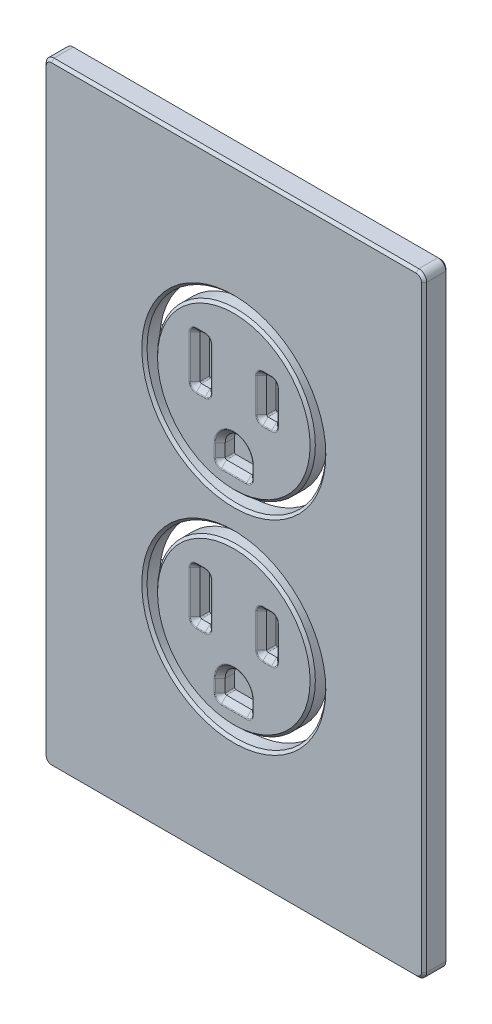
from build123d import *

# Parameters (mm, degrees)
SKETCH1_W                                    = 69.596
SKETCH1_H                                    = 114.046
FLANGE_EXTRUSION_DEPTH                       = 6.35
SKETCH2_W                                    = 63.6
SKETCH2_H                                    = 108
MOUNTING_BASE_CLEARANCE_CUT_DEPTH            = 3.25
MOUNTING_BASE_CLEARANCE_CUT_FILLETS_R        = 9.5
LIGHT_PIPE_CLEARANCE_OUTLINE_W               = 69.596
LIGHT_PIPE_CLEARANCE_OUTLINE_H               = 114.046
LIGHT_PIPE_CLEARANCE_DEPTH                   = 1.7
PERIMETER_OVERHANG_EXTENSION_BY              = 1.5
PERIMETER_OVERHANG_EXTENSION_2_BY            = 1.5
PERIMETER_OVERHANG_EXTENSION_3_BY            = 1.5
PERIMETER_OVERHANG_EXTENSION_4_BY            = 1.5
CORNER_ROUNDS_R                              = 1.5
PERIMETER_CHAMFERS_SIZE                      = 0.5
LIGHTPIPE_CHANNEL_DEPTH                      = 69.935450481
LIGHTPIPE_CHANNEL_DEPTH_BACK                 = 2.1
LIGHTPIPE_CHANNEL_DRAFT_ANGLE                = 15
LIGHTPIPE_CHANNEL_INSIDE_FILLETS_R           = 2.25
LIGHTPIPE_CHANNEL_OUTSIDE_ROUNDS_R           = 1
SKETCH14_R                                   = 1.25
LIGHTPIPE_MOUNTING_HOLE_DEPTH                = 3.25
LIGHTPIPE_MOUNTING_HOLE_MIRROR_2_COPY_1_R    = 1.25
LIGHTPIPE_MOUNTING_HOLE_MIRROR_2_COP_2_DEPTH = 3.25
LIGHTPIPE_START                              = 3.25
LIGHTPIPE_PCB_CLEARANCE_DEPTH                = 0.2
SKETCH18_R                                   = 17.0561
SKETCH18_R_2                                 = 15.0561
RECEPTACLE_INSERT_HOLES_DEPTH                = 70.022524099
SKETCH20_W                                   = 2
SKETCH20_H                                   = 15
SKETCH20_W_2                                 = 8
SKETCH20_H_2                                 = 2
BOSS_EXTRUDE1_DEPTH                          = 2
RECEPTACLE_INSERT_HOLES_CHAMFERS_SIZE        = 0.5
SKETCH19_W                                   = 2.159
SKETCH19_H                                   = 8.636
SKETCH19_H_2                                 = 6.985
CUT_EXTRUDE1_DEPTH                           = 2.8
FILLET1_R                                    = 0.25
CHAMFER1_SIZE                                = 1
FILLET2_R                                    = 0.25
CHAMFER2_SIZE                                = 0.5


with BuildPart() as part:
    # Sketch1 → Flange Extrusion (new body)
    with BuildSketch(Plane.XY):
        Rectangle(SKETCH1_W, SKETCH1_H)
    extrude(amount=FLANGE_EXTRUSION_DEPTH)

    # Sketch2 → Mounting Base Clearance Cut (cut)
    with BuildSketch(Plane(origin=(0, 0, 0), x_dir=(-1, 0, 0), z_dir=(0, 0, -1))):
        Rectangle(SKETCH2_W, SKETCH2_H)
    extrude(amount=-MOUNTING_BASE_CLEARANCE_CUT_DEPTH, mode=Mode.SUBTRACT)

    # Mounting Base Clearance Cut Fillets
    mounting_base_clearance_cut_fillets_edges = [part.edges().sort_by_distance(p)[0] for p in [
        (-31.8, -54, 1.625),
        (-31.8, 54, 1.625),
        (31.8, 54, 1.625),
        (31.8, -54, 1.625),
    ]]
    fillet(mounting_base_clearance_cut_fillets_edges, radius=MOUNTING_BASE_CLEARANCE_CUT_FILLETS_R)

    # Light Pipe Clearance: read off the stored shape, not the designer's step
    # Light Pipe Clearance outline → Light Pipe Clearance (cut)
    with BuildSketch(Plane.XY):
        Rectangle(LIGHT_PIPE_CLEARANCE_OUTLINE_W, LIGHT_PIPE_CLEARANCE_OUTLINE_H)
        with BuildLine():
            Line((22.3, -54), (-22.3, -54))
            ThreePointArc((-22.3, -54), (-29.017514421, -51.217514421), (-31.8, -44.5))
            Line((-31.8, -44.5), (-31.8, 44.5))
            ThreePointArc((-31.8, 44.5), (-29.017514421, 51.217514421), (-22.3, 54))
            Line((-22.3, 54), (22.3, 54))
            ThreePointArc((22.3, 54), (29.017514421, 51.217514421), (31.8, 44.5))
            Line((31.8, 44.5), (31.8, -44.5))
            ThreePointArc((31.8, -44.5), (29.017514421, -51.217514421), (22.3, -54))
        make_face(mode=Mode.SUBTRACT)
    extrude(amount=LIGHT_PIPE_CLEARANCE_DEPTH, mode=Mode.SUBTRACT)

    # Perimeter Overhang Extension: a face moved outward by 1.5
    extrude(part.faces().sort_by_distance((0, 57.023, 4.025))[0], amount=PERIMETER_OVERHANG_EXTENSION_BY, dir=(0, 1, 0))

    # Perimeter Overhang Extension 2: a face moved outward by 1.5
    extrude(part.faces().sort_by_distance((-34.798, 0, 4.025))[0], amount=PERIMETER_OVERHANG_EXTENSION_2_BY, dir=(-1, 0, 0))

    # Perimeter Overhang Extension 3: a face moved outward by 1.5
    extrude(part.faces().sort_by_distance((34.798, 0, 4.025))[0], amount=PERIMETER_OVERHANG_EXTENSION_3_BY, dir=(1, 0, 0))

    # Perimeter Overhang Extension 4: a face moved outward by 1.5
    extrude(part.faces().sort_by_distance((0, -57.023, 4.025))[0], amount=PERIMETER_OVERHANG_EXTENSION_4_BY, dir=(0, -1, 0))

    # Corner Rounds
    corner_rounds_edges = [part.edges().sort_by_distance(p)[0] for p in [
        (-36.298, 58.523, 4.025),
        (36.298, 58.523, 4.025),
        (36.298, -58.523, 4.025),
        (-36.298, -58.523, 4.025),
    ]]
    fillet(corner_rounds_edges, radius=CORNER_ROUNDS_R)

    # Perimeter Chamfers
    perimeter_chamfers_edges = [part.edges().sort_by_distance(p)[0] for p in [
        (-36.298, 0, 1.7),
        (-36.298, 0, 6.35),
        (0, 58.523, 1.7),
        (36.298, 0, 1.7),
        (0, -58.523, 1.7),
        (-35.858660172, -58.083660172, 1.7),
        (35.858660172, -58.083660172, 1.7),
        (35.858660172, 58.083660172, 1.7),
        (-35.858660172, 58.083660172, 1.7),
        (0, 58.523, 6.35),
        (0, -58.523, 6.35),
        (36.298, 0, 6.35),
        (-35.858660172, -58.083660172, 6.35),
        (35.858660172, -58.083660172, 6.35),
        (35.858660172, 58.083660172, 6.35),
        (-35.858660172, 58.083660172, 6.35),
    ]]
    chamfer(perimeter_chamfers_edges, length=PERIMETER_CHAMFERS_SIZE)

    # Sketch13 → Lightpipe Channel (cut, two sides: drawn at the far end of the back side and taken through both)
    with BuildSketch(Plane(origin=(0, 0, 3.25), x_dir=(-1, 0, 0), z_dir=(0, 0, -1)).offset(-LIGHTPIPE_CHANNEL_DEPTH_BACK)):
        with BuildLine():
            Line((22.3, 54.65), (-22.3, 54.65))
            ThreePointArc((-22.3, 54.65), (-29.477133829, 51.677133829), (-32.45, 44.5))
            Line((-32.45, 44.5), (-32.45, -44.5))
            ThreePointArc((-32.45, -44.5), (-29.477133829, -51.677133829), (-22.3, -54.65))
            Line((-22.3, -54.65), (22.3, -54.65))
            ThreePointArc((22.3, -54.65), (29.477133829, -51.677133829), (32.45, -44.5))
            Line((32.45, -44.5), (32.45, 44.5))
            ThreePointArc((32.45, 44.5), (29.477133829, 51.677133829), (22.3, 54.65))
        make_face()
        with BuildLine():
            Line((22.3, 51), (-22.3, 51))
            ThreePointArc((-22.3, 51), (-26.896194078, 49.096194078), (-28.8, 44.5))
            Line((-28.8, 44.5), (-28.8, -44.5))
            ThreePointArc((-28.8, -44.5), (-26.896194078, -49.096194078), (-22.3, -51))
            Line((-22.3, -51), (22.3, -51))
            ThreePointArc((22.3, -51), (26.896194078, -49.096194078), (28.8, -44.5))
            Line((28.8, -44.5), (28.8, 44.5))
            ThreePointArc((28.8, 44.5), (26.896194078, 49.096194078), (22.3, 51))
        make_face(mode=Mode.SUBTRACT)
    extrude(amount=LIGHTPIPE_CHANNEL_DEPTH + LIGHTPIPE_CHANNEL_DEPTH_BACK, mode=Mode.SUBTRACT)

    # Lightpipe Channel Draft
    lightpipe_channel_draft_faces = [part.faces().sort_by_distance(p)[0] for p in [
        (0, 51, 4.3),
        (26.896194078, 49.096194078, 4.3),
        (28.8, 0, 4.3),
        (26.896194078, -49.096194078, 4.3),
        (0, -51, 4.3),
        (-26.896194078, -49.096194078, 4.3),
        (-28.8, 0, 4.3),
        (-26.896194078, 49.096194078, 4.3),
        (-32.45, 0, 3.525),
        (-29.477133829, 51.677133829, 3.525),
        (0, 54.65, 3.525),
        (29.477133829, 51.677133829, 3.525),
        (32.45, 0, 3.525),
        (29.477133829, -51.677133829, 3.525),
        (0, -54.65, 3.525),
        (-29.477133829, -51.677133829, 3.525),
    ]]
    draft(lightpipe_channel_draft_faces, Plane(origin=(0, 0, 5.35), x_dir=(-1, 0, 0), z_dir=(0, 0, -1)), LIGHTPIPE_CHANNEL_DRAFT_ANGLE)

    # Lightpipe Channel Inside Fillets
    lightpipe_channel_inside_fillets_edges = [part.edges().sort_by_distance(p)[0] for p in [
        (-29.477133829, 51.677133829, 5.35),
        (-32.45, 0, 5.35),
        (-29.477133829, -51.677133829, 5.35),
        (0, -54.65, 5.35),
        (29.477133829, -51.677133829, 5.35),
        (32.45, 1.69e-07, 5.35),
        (29.477131824, 51.677135834, 5.35),
        (-2.667e-06, 54.65, 5.35),
        (-28.8, -1.12e-07, 5.35),
        (-26.896194078, 49.096194078, 5.35),
        (0, 51, 5.35),
        (26.896194078, 49.096194078, 5.35),
        (28.8, 0, 5.35),
        (26.896193999, -49.096194157, 5.35),
        (-1.12e-07, -51, 5.35),
        (-26.896193999, -49.096194157, 5.35),
    ]]
    fillet(lightpipe_channel_inside_fillets_edges, radius=LIGHTPIPE_CHANNEL_INSIDE_FILLETS_R)

    # Lightpipe Channel Outside Rounds
    lightpipe_channel_outside_rounds_edges = [part.edges().sort_by_distance(p)[0] for p in [
        (-30.168694551, 52.368694551, 1.7),
        (0, 55.628014552, 1.7),
        (30.168694551, 52.368694551, 1.7),
        (33.428014552, 0, 1.7),
        (30.168694551, -52.368694551, 1.7),
        (0, -55.628014552, 1.7),
        (-30.168694551, -52.368694551, 1.7),
        (-33.428014552, 0, 1.7),
    ]]
    fillet(lightpipe_channel_outside_rounds_edges, radius=LIGHTPIPE_CHANNEL_OUTSIDE_ROUNDS_R)

    # Sketch14 → Lightpipe Mounting Hole (cut)
    with BuildSketch(Plane(origin=(0, 0, 1.7), x_dir=(-1, 0, 0), z_dir=(0, 0, -1))):
        with Locations((-32, 54.219403104)):
            Circle(SKETCH14_R)
    lightpipe_mounting_hole = extrude(amount=-LIGHTPIPE_MOUNTING_HOLE_DEPTH, mode=Mode.SUBTRACT)

    # Lightpipe Mounting Hole Mirror: Lightpipe Mounting Hole across plane
    add(lightpipe_mounting_hole.mirror(Plane(origin=(0, 0, 0), x_dir=(0, 0, 1), z_dir=(1, 0, 0))), mode=Mode.SUBTRACT)

    # Lightpipe Mounting Hole Mirror 2: Lightpipe Mounting Hole across plane
    add(lightpipe_mounting_hole.mirror(Plane.ZX), mode=Mode.SUBTRACT)

    # Lightpipe Mounting Hole Mirror 2 copy 1 → Lightpipe Mounting Hole Mirror 2 cop 2 (cut)
    with BuildSketch(Plane(origin=(0, 0, 1.7), x_dir=(1, 0, 0), z_dir=(0, 0, -1))):
        with Locations((-32, 54.219403104)):
            Circle(LIGHTPIPE_MOUNTING_HOLE_MIRROR_2_COPY_1_R)
    extrude(amount=-LIGHTPIPE_MOUNTING_HOLE_MIRROR_2_COP_2_DEPTH, mode=Mode.SUBTRACT)

    # Lightpipe PCB Clearance: read off the stored shape, not the designer's step
    # Lightpipe PCB Clearance outline → Lightpipe PCB Clearance (cut)
    with BuildSketch(Plane.XY.offset(LIGHTPIPE_START)):
        with BuildLine():
            ThreePointArc((-22.3, 50.490896534), (-26.536203565, 48.736203565), (-28.290896534, 44.5))
            Line((-28.290896534, 44.5), (-28.290896534, -44.5))
            ThreePointArc((-28.290896534, -44.5), (-26.536203565, -48.736203565), (-22.3, -50.490896534))
            Line((-22.3, -50.490896534), (22.3, -50.490896534))
            ThreePointArc((22.3, -50.490896534), (26.536203565, -48.736203565), (28.290896534, -44.5))
            Line((28.290896534, -44.5), (28.290896534, 44.5))
            ThreePointArc((28.290896534, 44.5), (26.536203565, 48.736203565), (22.3, 50.490896534))
            Line((22.3, 50.490896534), (-22.3, 50.490896534))
        make_face()
    extrude(amount=LIGHTPIPE_PCB_CLEARANCE_DEPTH, mode=Mode.SUBTRACT)

    # Sketch18 → Receptacle Insert Holes (cut, through all)
    # profile 1 of 2: a face of its own
    with BuildSketch(Plane.XY.offset(6.35)):
        with Locations((0, 19.4437)):
            Circle(SKETCH18_R)
        with Locations((0, 19.4437)):
            Circle(SKETCH18_R_2, mode=Mode.SUBTRACT)
    # profile 2 of 2: a face of its own
    with BuildSketch(Plane.XY.offset(6.35)):
        with Locations((0, -19.4437)):
            Circle(SKETCH18_R)
        with Locations((0, -19.4437)):
            Circle(SKETCH18_R_2, mode=Mode.SUBTRACT)
    extrude(amount=-RECEPTACLE_INSERT_HOLES_DEPTH, mode=Mode.SUBTRACT)


with BuildPart() as receptacle_insert_holes_piece_1:
    # of the separate pieces the step leaves, piece 1, a body of its own (receptacle_insert_holes_pieces)
    add(part.part.solids().sort_by_distance((-33.229415714, 44.5, 2.441180955))[0])



with BuildPart() as receptacle_insert_holes_piece_2:
    # of the separate pieces the step leaves, piece 2, a body of its own (receptacle_insert_holes_pieces)
    add(part.part.solids().sort_by_distance((15.0561, -19.4437, 3.45))[0])


with BuildPart() as receptacle_insert_holes_piece_3:
    # of the separate pieces the step leaves, piece 3, a body of its own (receptacle_insert_holes_pieces)
    add(part.part.solids().sort_by_distance((15.0561, 19.4437, 3.45))[0])


with BuildPart() as receptacle_insert_holes_piece_1_1:
    add(receptacle_insert_holes_piece_1.part)

    add(receptacle_insert_holes_piece_2.part)  # Boss-Extrude1 merges Receptacle Insert Holes piece 2

    add(receptacle_insert_holes_piece_3.part)  # Boss-Extrude1 merges Receptacle Insert Holes piece 3
    # Sketch20 → Boss-Extrude1 (add)
    with BuildSketch(Plane(origin=(0, 0, 3.45), x_dir=(-1, 0, 0), z_dir=(0, 0, -1))):
        Rectangle(SKETCH20_W, SKETCH20_H)
        with Locations((-15.0561, 19.4437)):
            Rectangle(SKETCH20_W_2, SKETCH20_H_2)
        with Locations((15.0561, 19.4437)):
            Rectangle(SKETCH20_W_2, SKETCH20_H_2)
        with Locations((15.0561, -19.4437)):
            Rectangle(SKETCH20_W_2, SKETCH20_H_2)
        with Locations((-15.0561, -19.4437)):
            Rectangle(SKETCH20_W_2, SKETCH20_H_2)
    extrude(amount=BOSS_EXTRUDE1_DEPTH)

    # Receptacle Insert Holes Chamfers
    receptacle_insert_holes_chamfers_edges = [receptacle_insert_holes_piece_1_1.edges().sort_by_distance(p)[0] for p in [
        (-17.0561, 19.4437, 6.35),
        (-17.0561, -19.4437, 6.35),
    ]]
    chamfer(receptacle_insert_holes_chamfers_edges, length=RECEPTACLE_INSERT_HOLES_CHAMFERS_SIZE)

    # Sketch19 → Cut-Extrude1 (cut)
    with BuildSketch(Plane.XY.offset(6.35)):
        with Locations((-6.35, 22.6187)):
            Rectangle(SKETCH19_W, SKETCH19_H)
        with Locations((6.35, 22.6187)):
            Rectangle(SKETCH19_W, SKETCH19_H_2)
        with BuildLine():
            Line((-2.64795, 10.7315), (-2.64795, 8.08355))
            Line((-2.64795, 8.08355), (2.64795, 8.08355))
            Line((2.64795, 8.08355), (2.64795, 10.7315))
            ThreePointArc((2.64795, 10.7315), (0, 13.37945), (-2.64795, 10.7315))
        make_face()
        with Locations((-6.35, -16.2687)):
            Rectangle(SKETCH19_W, SKETCH19_H)
        with Locations((6.35, -16.2687)):
            Rectangle(SKETCH19_W, SKETCH19_H_2)
        with BuildLine():
            Line((-2.64795, -28.1559), (-2.64795, -30.80385))
            Line((-2.64795, -30.80385), (2.64795, -30.80385))
            Line((2.64795, -30.80385), (2.64795, -28.1559))
            ThreePointArc((2.64795, -28.1559), (0, -25.50795), (-2.64795, -28.1559))
        make_face()
    extrude(amount=-CUT_EXTRUDE1_DEPTH, mode=Mode.SUBTRACT)

    # Fillet1
    fillet1_edges = [receptacle_insert_holes_piece_1_1.edges().sort_by_distance(p)[0] for p in [
        (-7.4295, 18.3007, 4.95),
        (-7.4295, 26.9367, 4.95),
        (-5.2705, 26.9367, 4.95),
        (-5.2705, 18.3007, 4.95),
        (5.2705, 19.1262, 4.95),
        (5.2705, 26.1112, 4.95),
        (7.4295, 26.1112, 4.95),
        (7.4295, 19.1262, 4.95),
        (2.64795, 8.08355, 4.95),
        (-2.64795, 8.08355, 4.95),
        (-7.4295, -20.5867, 4.95),
        (-7.4295, -11.9507, 4.95),
        (-5.2705, -11.9507, 4.95),
        (-5.2705, -20.5867, 4.95),
        (5.2705, -19.7612, 4.95),
        (5.2705, -12.7762, 4.95),
        (7.4295, -12.7762, 4.95),
        (7.4295, -19.7612, 4.95),
        (2.64795, -30.80385, 4.95),
        (-2.64795, -30.80385, 4.95),
    ]]
    fillet(fillet1_edges, radius=FILLET1_R)

    # Chamfer1
    chamfer1_edges = [receptacle_insert_holes_piece_1_1.edges().sort_by_distance(p)[0] for p in [
        (0, 13.37945, 6.35),
        (-2.64795, 9.532525, 6.35),
        (0, -25.50795, 6.35),
        (-2.64795, -29.354875, 6.35),
        (0, -30.80385, 6.35),
        (2.64795, -29.354875, 6.35),
        (6.35, -12.7762, 6.35),
        (7.4295, -16.2687, 6.35),
        (5.2705, -16.2687, 6.35),
        (6.35, -19.7612, 6.35),
        (-5.2705, -16.2687, 6.35),
        (-6.35, -20.5867, 6.35),
        (-7.4295, -16.2687, 6.35),
        (-6.35, -11.9507, 6.35),
        (2.64795, 9.532525, 6.35),
        (0, 8.08355, 6.35),
        (6.35, 19.1262, 6.35),
        (5.2705, 22.6187, 6.35),
        (6.35, 26.1112, 6.35),
        (7.4295, 22.6187, 6.35),
        (-5.2705, 22.6187, 6.35),
        (-6.35, 18.3007, 6.35),
        (-7.4295, 22.6187, 6.35),
        (-6.35, 26.9367, 6.35),
        (-2.574726695, -30.730626695, 6.35),
        (2.574726695, -30.730626695, 6.35),
        (7.356276695, -12.849423305, 6.35),
        (5.343723305, -12.849423305, 6.35),
        (5.343723305, -19.687976695, 6.35),
        (7.356276695, -19.687976695, 6.35),
        (-5.343723305, -20.513476695, 6.35),
        (-7.356276695, -20.513476695, 6.35),
        (-7.356276695, -12.023923305, 6.35),
        (-5.343723305, -12.023923305, 6.35),
        (2.574726695, 8.156773305, 6.35),
        (-2.574726695, 8.156773305, 6.35),
        (5.343723305, 19.199423305, 6.35),
        (5.343723305, 26.037976695, 6.35),
        (7.356276695, 26.037976695, 6.35),
        (7.356276695, 19.199423305, 6.35),
        (-5.343723305, 18.373923305, 6.35),
        (-7.356276695, 18.373923305, 6.35),
        (-5.343723305, 26.863476695, 6.35),
        (-7.356276695, 26.863476695, 6.35),
    ]]
    chamfer(chamfer1_edges, length=CHAMFER1_SIZE)

    # Fillet2
    fillet2_edges = [receptacle_insert_holes_piece_1_1.edges().sort_by_distance(p)[0] for p in [
        (8.4295, -16.2687, 6.35),
        (8.063383476, -12.142316524, 6.35),
        (8.063383476, -20.395083476, 6.35),
        (6.35, -11.7762, 6.35),
        (6.35, -20.7612, 6.35),
        (4.636616524, -12.142316524, 6.35),
        (4.636616524, -20.395083476, 6.35),
        (4.2705, -16.2687, 6.35),
        (-4.2705, -16.2687, 6.35),
        (-4.636616524, -11.316816524, 6.35),
        (-4.636616524, -21.220583476, 6.35),
        (-6.35, -10.9507, 6.35),
        (-6.35, -21.5867, 6.35),
        (-8.063383476, -11.316816524, 6.35),
        (-8.063383476, -21.220583476, 6.35),
        (-8.4295, -16.2687, 6.35),
        (0, -24.50795, 6.35),
        (-3.64795, -29.354875, 6.35),
        (3.64795, -29.354875, 6.35),
        (-3.281833476, -31.437733476, 6.35),
        (3.281833476, -31.437733476, 6.35),
        (0, -31.80385, 6.35),
        (-4.2705, 22.6187, 6.35),
        (-4.636616524, 27.570583476, 6.35),
        (-4.636616524, 17.666816524, 6.35),
        (-6.35, 27.9367, 6.35),
        (-6.35, 17.3007, 6.35),
        (-8.063383476, 27.570583476, 6.35),
        (-8.063383476, 17.666816524, 6.35),
        (-8.4295, 22.6187, 6.35),
        (0, 14.37945, 6.35),
        (-3.64795, 9.532525, 6.35),
        (3.64795, 9.532525, 6.35),
        (-3.281833476, 7.449666524, 6.35),
        (3.281833476, 7.449666524, 6.35),
        (0, 7.08355, 6.35),
        (8.4295, 22.6187, 6.35),
        (8.063383476, 26.745083476, 6.35),
        (8.063383476, 18.492316524, 6.35),
        (6.35, 27.1112, 6.35),
        (6.35, 18.1262, 6.35),
        (4.636616524, 26.745083476, 6.35),
        (4.636616524, 18.492316524, 6.35),
        (4.2705, 22.6187, 6.35),
    ]]
    fillet(fillet2_edges, radius=FILLET2_R)

    # Chamfer2
    chamfer2_edges = [receptacle_insert_holes_piece_1_1.edges().sort_by_distance(p)[0] for p in [
        (-15.0561, 19.4437, 6.35),
        (-15.0561, -19.4437, 6.35),
    ]]
    chamfer(chamfer2_edges, length=CHAMFER2_SIZE)


solid = receptacle_insert_holes_piece_1_1.part
